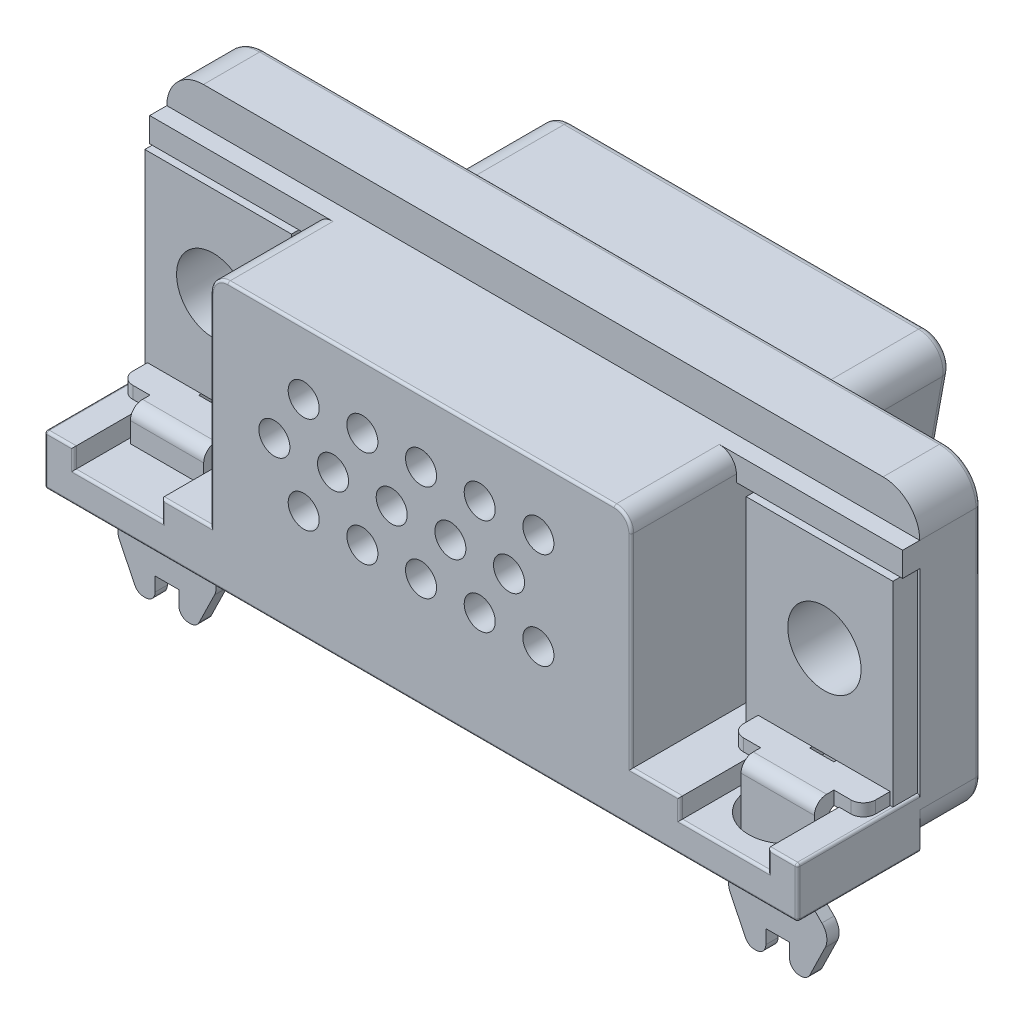
from build123d import *

# Parameters (mm, degrees)
EXTRUDE_1_DEPTH     = 2.5
EXTRUDE_3_DEPTH     = 5
SKETCH_3_W          = 30.8
SKETCH_3_H          = 1
EXTRUDE_4_DEPTH     = 0.7
FILLET_1_R          = 0.7
EXTRUDE_5_DEPTH     = 5.9
CUT_EXTRUDE_1_DEPTH = 0.1
FILLET_2_R          = 0.3
SKETCH_6_R          = 1.5
CUT_EXTRUDE_2_DEPTH = 19.242412806
SKETCH_7_R          = 0.635
CUT_EXTRUDE_3_DEPTH = 16.1
FILLET_3_R          = 0.15
FILLET_4_R          = 0.3
SKETCH_8_R          = 1.6
CUT_EXTRUDE_4_DEPTH = 9.1
FILLET_5_R          = 0.2
SKETCH_9_W          = 6
SKETCH_9_H          = 8
EXTRUDE_6_DEPTH     = 1
EXTRUDE_7_DEPTH     = 0.5
SKETCH_11_W         = 3
SKETCH_11_H         = 0.5
EXTRUDE_8_DEPTH     = 5
FILLET_6_R          = 0.5
SKETCH_12_R         = 0.7
CUT_EXTRUDE_5_DEPTH = 0.5
CUT_EXTRUDE_6_DEPTH = 7
SKETCH_14_R         = 1.5
CUT_EXTRUDE_7_DEPTH = 7
EXTRUDE_9_DEPTH     = 0.5
FILLET_9_R          = 0.1


# Some blends are built 0.0001 mm under size
with BuildPart() as part:
    # Эскиз1 → Бобышка-Вытянуть1 (new body)
    with BuildSketch(Plane.XY):
        with BuildLine():
            Line((-13.9, -6.275), (13.9, -6.275))
            ThreePointArc((13.9, -6.275), (14.960660172, -5.835660172), (15.4, -4.775))
            Line((15.4, -4.775), (15.4, 4.775))
            ThreePointArc((15.4, 4.775), (14.960660172, 5.835660172), (13.9, 6.275))
            Line((13.9, 6.275), (-13.9, 6.275))
            ThreePointArc((-13.9, 6.275), (-14.960660172, 5.835660172), (-15.4, 4.775))
            Line((-15.4, 4.775), (-15.4, -4.775))
            ThreePointArc((-15.4, -4.775), (-14.960660172, -5.835660172), (-13.9, -6.275))
        make_face()
    extrude(amount=EXTRUDE_1_DEPTH)

    # Эскиз2 → Бобышка-Вытянуть3 (add)
    with BuildSketch(Plane.XY.offset(2.5)):
        Polygon((-8.6, -4.225), (-8.6, 4.775), (8.6, 4.775), (8.6, -4.225), (10.6, -4.225), (10.6, -5.047700411), (14.2, -5.047700411), (14.2, -4.225), (15.4, -4.225), (15.4, -6.275), (-15.4, -6.275), (-15.4, -4.225), (-14.2, -4.225), (-14.2, -5.047700411), (-10.6, -5.047700411), (-10.6, -4.225), align=None)
    extrude(amount=EXTRUDE_3_DEPTH)

    # Эскиз3 → Бобышка-Вытянуть4 (add)
    with BuildSketch(Plane.XY.offset(2.5)):
        with Locations((0, 4.275)):
            Rectangle(SKETCH_3_W, SKETCH_3_H)
    extrude(amount=EXTRUDE_4_DEPTH)

    # Скругление1
    fillet_1_edges = [part.edges().sort_by_distance(p)[0] for p in [
        (8.6, 4.775, 5.35),
        (-8.6, 4.775, 5.35),
    ]]
    fillet(fillet_1_edges, radius=FILLET_1_R)

    # Эскиз4 → Бобышка-Вытянуть5 (add)
    with BuildSketch(Plane(origin=(0, 0, 0), x_dir=(-1, 0, 0), z_dir=(0, 0, -1))):
        with BuildLine():
            Line((-7.249750965, 4.130528622), (7.249750965, 4.130528622))
            ThreePointArc((7.249750965, 4.130528622), (8.018037572, 3.77063462), (8.233320696, 2.95))
            Line((8.233320696, 2.95), (7.150409304, -2.95))
            ThreePointArc((7.150409304, -2.95), (6.806945571, -3.537757986), (6.166839572, -3.769471378))
            Line((6.166839572, -3.769471378), (-6.166839572, -3.769471378))
            ThreePointArc((-6.166839572, -3.769471378), (-6.806945571, -3.537757986), (-7.150409304, -2.95))
            Line((-7.150409304, -2.95), (-8.233320696, 2.95))
            ThreePointArc((-8.233320696, 2.95), (-8.018037572, 3.77063462), (-7.249750965, 4.130528622))
        make_face()
    extrude(amount=EXTRUDE_5_DEPTH)

    # Эскиз5 → Вырез-Вытянуть1 (cut)
    with BuildSketch(Plane(origin=(0, 0, -5.9), x_dir=(-1, 0, 0), z_dir=(0, 0, -1))):
        with BuildLine():
            Line((6.658624438, -2.859735689), (7.74153583, 3.040264311))
            ThreePointArc((7.74153583, 3.040264311), (7.633894268, 3.450581621), (7.249750965, 3.630528622))
            Line((7.249750965, 3.630528622), (-7.249750965, 3.630528622))
            ThreePointArc((-7.249750965, 3.630528622), (-7.633894268, 3.450581621), (-7.74153583, 3.040264311))
            Line((-7.74153583, 3.040264311), (-6.658624438, -2.859735689))
            ThreePointArc((-6.658624438, -2.859735689), (-6.486892571, -3.153614682), (-6.166839572, -3.269471378))
            Line((-6.166839572, -3.269471378), (6.166839572, -3.269471378))
            ThreePointArc((6.166839572, -3.269471378), (6.486892571, -3.153614682), (6.658624438, -2.859735689))
        make_face()
    extrude(amount=-CUT_EXTRUDE_1_DEPTH, mode=Mode.SUBTRACT)

    # Скругление2
    fillet_2_edges = [part.edges().sort_by_distance(p)[0] for p in [
        (-6.806945571, -3.537757986, 0),
        (-7.691865, 0, 0),
        (-8.018037572, 3.77063462, 0),
        (0, 4.130528622, 0),
        (8.018037572, 3.77063462, 0),
        (7.691865, 0, 0),
        (6.806945571, -3.537757986, 0),
        (0, -3.769471378, 0),
        (-6.806945571, -3.537757986, -5.9),
        (-7.691865, 0, -5.9),
        (-8.018037572, 3.77063462, -5.9),
        (0, 4.130528622, -5.9),
        (8.018037572, 3.77063462, -5.9),
        (7.691865, 0, -5.9),
        (6.806945571, -3.537757986, -5.9),
        (0, -3.769471378, -5.9),
    ]]
    fillet(fillet_2_edges, radius=FILLET_2_R)

    # Эскиз6 → Вырез-Вытянуть2 (cut, through all)
    with BuildSketch(Plane(origin=(0, 0, 0), x_dir=(-1, 0, 0), z_dir=(0, 0, -1))):
        with Locations((-12.5, 0)):
            Circle(SKETCH_6_R)
        with Locations((12.5, 0)):
            Circle(SKETCH_6_R)
    extrude(amount=-CUT_EXTRUDE_2_DEPTH, mode=Mode.SUBTRACT)

    # Эскиз7 → Вырез-Вытянуть3 (cut)
    with BuildSketch(Plane(origin=(0, 0, -5.8), x_dir=(-1, 0, 0), z_dir=(0, 0, -1))):
        with Locations((-4.8, 2.170528622)):
            Circle(SKETCH_7_R)
        with Locations((-2.4, 2.170528622)):
            Circle(SKETCH_7_R)
        with Locations((0, 2.170528622)):
            Circle(SKETCH_7_R)
        with Locations((2.4, 2.170528622)):
            Circle(SKETCH_7_R)
        with Locations((4.8, 2.170528622)):
            Circle(SKETCH_7_R)
        with Locations((-3.6, 0.190528622)):
            Circle(SKETCH_7_R)
        with Locations((-4.8, -1.789471378)):
            Circle(SKETCH_7_R)
        with Locations((-1.2, 0.190528622)):
            Circle(SKETCH_7_R)
        with Locations((1.2, 0.190528622)):
            Circle(SKETCH_7_R)
        with Locations((3.6, 0.190528622)):
            Circle(SKETCH_7_R)
        with Locations((6, 0.190528622)):
            Circle(SKETCH_7_R)
        with Locations((-2.4, -1.789471378)):
            Circle(SKETCH_7_R)
        with Locations((0, -1.789471378)):
            Circle(SKETCH_7_R)
        with Locations((2.4, -1.789471378)):
            Circle(SKETCH_7_R)
        with Locations((4.8, -1.789471378)):
            Circle(SKETCH_7_R)
    extrude(amount=-CUT_EXTRUDE_3_DEPTH, mode=Mode.SUBTRACT)

    # Скругление3
    fillet_3_edges = [part.edges().sort_by_distance(p)[0] for p in [
        (5.435, 2.170528622, -5.8),
        (3.035, 2.170528622, -5.8),
        (0.635, 2.170528622, -5.8),
        (-1.765, 2.170528622, -5.8),
        (-4.165, 2.170528622, -5.8),
        (4.235, 0.190528622, -5.8),
        (5.435, -1.789471378, -5.8),
        (1.835, 0.190528622, -5.8),
        (-0.565, 0.190528622, -5.8),
        (-2.965, 0.190528622, -5.8),
        (-5.365, 0.190528622, -5.8),
        (3.035, -1.789471378, -5.8),
        (0.635, -1.789471378, -5.8),
        (-1.765, -1.789471378, -5.8),
        (-4.165, -1.789471378, -5.8),
    ]]
    fillet(fillet_3_edges, radius=FILLET_3_R)

    # Скругление4
    fillet_4_edges = [part.edges().sort_by_distance(p)[0] for p in [
        (14, 0, 0),
        (-11, 0, 0),
    ]]
    fillet(fillet_4_edges, radius=FILLET_4_R)

    # Эскиз8 → Вырез-Вытянуть4 (cut)
    with BuildSketch(Plane.XZ.offset(6.275)):
        with Locations((-12.5, 11.4)):
            Circle(SKETCH_8_R)
        with Locations(Location((12.5, 5, 0), (0, 0, 270))):
            Circle(SKETCH_8_R)
    extrude(amount=-CUT_EXTRUDE_4_DEPTH, mode=Mode.SUBTRACT)

    # Скругление5
    fillet_5_edges = [part.edges().sort_by_distance(p)[0] for p in [
        (15.4, 0, 0),
        (14.960660172, -5.835660172, 0),
        (0, -6.275, 0),
        (-14.960660172, -5.835660172, 0),
        (-15.4, 0, 0),
        (-14.960660172, 5.835660172, 0),
        (0, 6.275, 0),
        (14.960660172, 5.835660172, 0),
    ]]
    fillet(fillet_5_edges, radius=FILLET_5_R)

    # Эскиз9 → Бобышка-Вытянуть6 (add)
    with BuildSketch(Plane.XY.offset(2.5)):
        with Locations((-12.3, -0.225)):
            Rectangle(SKETCH_9_W, SKETCH_9_H)
        with Locations((12.3, -0.225)):
            Rectangle(SKETCH_9_W, SKETCH_9_H)
    extrude(amount=EXTRUDE_6_DEPTH)

    # Эскиз10 → Бобышка-Вытянуть7 (add)
    with BuildSketch(Plane(origin=(0, -4.225, 0), x_dir=(1, 0, 0), z_dir=(0, 1, 0))):
        with BuildLine():
            Line((-13.990055245, -5.4), (-10.990055245, -5.4))
            Line((-10.990055245, -5.4), (-10.990055245, -4.6))
            Line((-10.990055245, -4.6), (-10.290055245, -4.6))
            ThreePointArc((-10.290055245, -4.6), (-9.936501855, -4.453553391), (-9.790055245, -4.1))
            Line((-9.790055245, -4.1), (-9.790055245, -3.5))
            Line((-9.790055245, -3.5), (-15.190055245, -3.5))
            Line((-15.190055245, -3.5), (-15.190055245, -4.1))
            ThreePointArc((-15.190055245, -4.1), (-15.043608636, -4.453553391), (-14.690055245, -4.6))
            Line((-14.690055245, -4.6), (-13.990055245, -4.6))
            Line((-13.990055245, -4.6), (-13.990055245, -5.4))
        make_face()
        with BuildLine():
            Line((15.190055245, -3.5), (9.790055245, -3.5))
            Line((9.790055245, -3.5), (9.790055245, -4.1))
            ThreePointArc((9.790055245, -4.1), (9.936501855, -4.453553391), (10.290055245, -4.6))
            Line((10.290055245, -4.6), (10.990055245, -4.6))
            Line((10.990055245, -4.6), (10.990055245, -5.4))
            Line((10.990055245, -5.4), (13.990055245, -5.4))
            Line((13.990055245, -5.4), (13.990055245, -4.6))
            Line((13.990055245, -4.6), (14.690055245, -4.6))
            ThreePointArc((14.690055245, -4.6), (15.043608636, -4.453553391), (15.190055245, -4.1))
            Line((15.190055245, -4.1), (15.190055245, -3.5))
        make_face()
    extrude(amount=EXTRUDE_7_DEPTH)

    # Эскиз11 → Бобышка-Вытянуть8 (add)
    with BuildSketch(Plane.XZ.offset(4.225)):
        with Locations((-12.490055245, 5.15)):
            Rectangle(SKETCH_11_W, SKETCH_11_H)
        with Locations((12.490055245, 5.15)):
            Rectangle(SKETCH_11_W, SKETCH_11_H)
    extrude(amount=EXTRUDE_8_DEPTH)

    # Скругление6
    # the kernel refuses this fillet: 0.5 mm, written as the material it adds along each edge
    with BuildSketch(Plane(origin=(9.740055245, -4.225, 4.9), x_dir=(0, -1, 0), z_dir=(1, 0, 0))) as fillet_6_piece_1_section:
        with BuildLine():
            CenterArc((FILLET_6_R, FILLET_6_R), FILLET_6_R, 180, 90)
            Line((0, FILLET_6_R), (0, 0))
            Line((0, 0), (FILLET_6_R, 0))
        make_face()
    fillet_6_piece_1 = extrude(amount=4.25, mode=Mode.PRIVATE)
    fillet_6_piece_1 = split(fillet_6_piece_1, bisect_by=Plane(origin=(10.990055245, -4.230065924, 4.529125667), z_dir=(-1, 0, 0)), keep=Keep.TOP, mode=Mode.PRIVATE)
    fillet_6_piece_1 = split(fillet_6_piece_1, bisect_by=Plane(origin=(10.365055245, -4.230065924, 4.6), z_dir=(0, 0, -1)), keep=Keep.TOP, mode=Mode.PRIVATE)
    add(fillet_6_piece_1)
    with BuildSketch(Plane(origin=(10.990055245, -4.225, 4.9), x_dir=(0, -1, 0), z_dir=(1, 0, 0))) as fillet_6_piece_2_section:
        with BuildLine():
            CenterArc((FILLET_6_R, FILLET_6_R), FILLET_6_R, 180, 90)
            Line((0, FILLET_6_R), (0, 0))
            Line((0, 0), (FILLET_6_R, 0))
        make_face()
    fillet_6_piece_2 = extrude(amount=3, mode=Mode.PRIVATE)
    fillet_6_piece_2 = split(fillet_6_piece_2, bisect_by=Plane(origin=(12.490055245, -4.346872588, 4.6), z_dir=(0, 0, 1)), keep=Keep.TOP, mode=Mode.PRIVATE)
    add(fillet_6_piece_2)
    with BuildSketch(Plane(origin=(10.990055245, -4.225, 4.9), x_dir=(0, -1, 0), z_dir=(1, 0, 0))) as fillet_6_piece_3_section:
        with BuildLine():
            CenterArc((FILLET_6_R, FILLET_6_R), FILLET_6_R, 180, 90)
            Line((0, FILLET_6_R), (0, 0))
            Line((0, 0), (FILLET_6_R, 0))
        make_face()
    fillet_6_piece_3 = extrude(amount=3, mode=Mode.PRIVATE)
    fillet_6_piece_3 = split(fillet_6_piece_3, bisect_by=Plane(origin=(12.490055245, -4.230065924, 4.6), z_dir=(0, 0, -1)), keep=Keep.TOP, mode=Mode.PRIVATE)
    add(fillet_6_piece_3)
    with BuildSketch(Plane(origin=(10.990055245, -4.225, 4.9), x_dir=(0, -1, 0), z_dir=(1, 0, 0))) as fillet_6_piece_4_section:
        with BuildLine():
            CenterArc((FILLET_6_R, FILLET_6_R), FILLET_6_R, 180, 90)
            Line((0, FILLET_6_R), (0, 0))
            Line((0, 0), (FILLET_6_R, 0))
        make_face()
    fillet_6_piece_4 = extrude(amount=4.25, mode=Mode.PRIVATE)
    fillet_6_piece_4 = split(fillet_6_piece_4, bisect_by=Plane(origin=(13.990055245, -4.230065924, 4.529125667), z_dir=(1, 0, 0)), keep=Keep.TOP, mode=Mode.PRIVATE)
    fillet_6_piece_4 = split(fillet_6_piece_4, bisect_by=Plane(origin=(14.615055245, -4.230065924, 4.6), z_dir=(0, 0, -1)), keep=Keep.TOP, mode=Mode.PRIVATE)
    add(fillet_6_piece_4)
    with BuildSketch(Plane(origin=(-9.740055245, -4.225, 4.9), x_dir=(0, 0, -1), z_dir=(-1, 0, 0))) as fillet_6_piece_5_section:
        with BuildLine():
            CenterArc((FILLET_6_R, FILLET_6_R), FILLET_6_R, 180, 90)
            Line((0, FILLET_6_R), (0, 0))
            Line((0, 0), (FILLET_6_R, 0))
        make_face()
    fillet_6_piece_5 = extrude(amount=4.25, mode=Mode.PRIVATE)
    fillet_6_piece_5 = split(fillet_6_piece_5, bisect_by=Plane(origin=(-10.365055245, -4.230065924, 4.6), z_dir=(0, 0, -1)), keep=Keep.TOP, mode=Mode.PRIVATE)
    fillet_6_piece_5 = split(fillet_6_piece_5, bisect_by=Plane(origin=(-10.990055245, -4.230065924, 4.529125667), z_dir=(1, 0, 0)), keep=Keep.TOP, mode=Mode.PRIVATE)
    add(fillet_6_piece_5)
    with BuildSketch(Plane(origin=(-10.990055245, -4.225, 4.9), x_dir=(0, 0, -1), z_dir=(-1, 0, 0))) as fillet_6_piece_6_section:
        with BuildLine():
            CenterArc((FILLET_6_R, FILLET_6_R), FILLET_6_R, 180, 90)
            Line((0, FILLET_6_R), (0, 0))
            Line((0, 0), (FILLET_6_R, 0))
        make_face()
    fillet_6_piece_6 = extrude(amount=3, mode=Mode.PRIVATE)
    fillet_6_piece_6 = split(fillet_6_piece_6, bisect_by=Plane(origin=(-12.490055245, -4.230065924, 4.6), z_dir=(0, 0, -1)), keep=Keep.TOP, mode=Mode.PRIVATE)
    add(fillet_6_piece_6)
    with BuildSketch(Plane(origin=(-10.990055245, -4.225, 4.9), x_dir=(0, 0, -1), z_dir=(-1, 0, 0))) as fillet_6_piece_7_section:
        with BuildLine():
            CenterArc((FILLET_6_R, FILLET_6_R), FILLET_6_R, 180, 90)
            Line((0, FILLET_6_R), (0, 0))
            Line((0, 0), (FILLET_6_R, 0))
        make_face()
    fillet_6_piece_7 = extrude(amount=3, mode=Mode.PRIVATE)
    fillet_6_piece_7 = split(fillet_6_piece_7, bisect_by=Plane(origin=(-12.490055245, -4.346872588, 4.6), z_dir=(0, 0, 1)), keep=Keep.TOP, mode=Mode.PRIVATE)
    add(fillet_6_piece_7)
    with BuildSketch(Plane(origin=(-10.990055245, -4.225, 4.9), x_dir=(0, 0, -1), z_dir=(-1, 0, 0))) as fillet_6_piece_8_section:
        with BuildLine():
            CenterArc((FILLET_6_R, FILLET_6_R), FILLET_6_R, 180, 90)
            Line((0, FILLET_6_R), (0, 0))
            Line((0, 0), (FILLET_6_R, 0))
        make_face()
    fillet_6_piece_8 = extrude(amount=4.25, mode=Mode.PRIVATE)
    fillet_6_piece_8 = split(fillet_6_piece_8, bisect_by=Plane(origin=(-14.615055245, -4.230065924, 4.6), z_dir=(0, 0, -1)), keep=Keep.TOP, mode=Mode.PRIVATE)
    fillet_6_piece_8 = split(fillet_6_piece_8, bisect_by=Plane(origin=(-13.990055245, -4.230065924, 4.529125667), z_dir=(-1, 0, 0)), keep=Keep.TOP, mode=Mode.PRIVATE)
    add(fillet_6_piece_8)
    # the kernel refuses this fillet: 0.5 mm, written as the material it takes off along each edge
    with BuildSketch(Plane(origin=(9.740055245, -3.725, 5.4), x_dir=(0, -1, 0), z_dir=(1, 0, 0)), Plane(origin=(-15.240055245, -3.725, 5.4), x_dir=(0, -1, 0), z_dir=(1, 0, 0))) as fillet_6_2_piece_1:
        with BuildLine():
            CenterArc((FILLET_6_R, FILLET_6_R), FILLET_6_R, 180, 90)
            Line((0, FILLET_6_R), (0, 0))
            Line((0, 0), (FILLET_6_R, 0))
        make_face()
    extrude(amount=5.5, mode=Mode.SUBTRACT)

    # Эскиз12 → Вырез-Вытянуть5 (cut)
    with BuildSketch(Plane(origin=(0, -3.725, 0), x_dir=(1, 0, 0), z_dir=(0, 1, 0))):
        with Locations(Location((-12.490055245, -0.8, 0), (0, 0, 180))):
            Circle(SKETCH_12_R)
        with Locations(Location((12.490055245, -0.8, 0), (0, 0, 180))):
            Circle(SKETCH_12_R)
    extrude(amount=-CUT_EXTRUDE_5_DEPTH, mode=Mode.SUBTRACT)

    # Эскиз13 → Вырез-Вытянуть6 (cut)
    with BuildSketch(Plane(origin=(0, -3.725, 0), x_dir=(1, 0, 0), z_dir=(0, 1, 0))):
        with BuildLine():
            ThreePointArc((-11.995453545, -1.295347513), (-12.493890587, -1.499989493), (-12.990055245, -1.289897949))
            Line((-12.990055245, -1.289897949), (-12.990055245, -3.603621507))
            Line((-12.990055245, -3.603621507), (-12.005897844, -3.605845872))
            Line((-12.005897844, -3.605845872), (-11.995453545, -1.295347513))
        make_face()
    cut_extrude_6 = extrude(amount=-CUT_EXTRUDE_6_DEPTH, mode=Mode.SUBTRACT)

    # Зеркальное отражение1: Вырез-Вытянуть6 across plane
    add(cut_extrude_6.mirror(Plane(origin=(0, 0, 0), x_dir=(0, 0, 1), z_dir=(1, 0, 0))), mode=Mode.SUBTRACT)

    # Эскиз14 → Вырез-Вытянуть7 (cut)
    with BuildSketch(Plane(origin=(0, 0, 2.5), x_dir=(-1, 0, 0), z_dir=(0, 0, -1))):
        with Locations(Location((12.5, 0, 0), (0, 0, 180))):
            Circle(SKETCH_14_R)
        with Locations((-12.5, 0)):
            Circle(SKETCH_14_R)
    extrude(amount=-CUT_EXTRUDE_7_DEPTH, mode=Mode.SUBTRACT)

    # Эскиз15 → Бобышка-Вытянуть9 (add)
    with BuildSketch(Plane.XY.offset(5.4)):
        with BuildLine():
            Line((10.990055245, -7.575), (10.683208304, -7.881846941))
            ThreePointArc((10.683208304, -7.881846941), (10.487779531, -8.26130987), (10.549046337, -8.683720686))
            Line((10.549046337, -8.683720686), (11.175823232, -9.96860059))
            ThreePointArc((11.175823232, -9.96860059), (11.323372787, -10.132455574), (11.535329925, -10.193229733))
            Line((11.535329925, -10.193229733), (11.604282006, -10.193229733))
            ThreePointArc((11.604282006, -10.193229733), (11.886504212, -10.076691595), (12.004278165, -9.794982868))
            Line((12.004278165, -9.794982868), (12.014008078, -7.575))
            Line((12.014008078, -7.575), (10.990055245, -7.575))
        make_face()
        with BuildLine():
            Line((12.966102413, -7.575), (13.990055245, -7.575))
            Line((13.990055245, -7.575), (14.296902186, -7.881846941))
            ThreePointArc((14.296902186, -7.881846941), (14.492330959, -8.26130987), (14.431064153, -8.683720686))
            Line((14.431064153, -8.683720686), (13.804287259, -9.96860059))
            ThreePointArc((13.804287259, -9.96860059), (13.656737704, -10.132455574), (13.444780565, -10.193229733))
            Line((13.444780565, -10.193229733), (13.375828484, -10.193229733))
            ThreePointArc((13.375828484, -10.193229733), (13.093606279, -10.076691595), (12.975832326, -9.794982868))
            Line((12.975832326, -9.794982868), (12.966102413, -7.575))
        make_face()
        with BuildLine():
            Line((-13.990055245, -7.575), (-14.296902186, -7.881846941))
            ThreePointArc((-14.296902186, -7.881846941), (-14.492330959, -8.26130987), (-14.431064153, -8.683720686))
            Line((-14.431064153, -8.683720686), (-13.804287259, -9.96860059))
            ThreePointArc((-13.804287259, -9.96860059), (-13.656737704, -10.132455574), (-13.444780565, -10.193229733))
            Line((-13.444780565, -10.193229733), (-13.375828484, -10.193229733))
            ThreePointArc((-13.375828484, -10.193229733), (-13.093606279, -10.076691595), (-12.975832326, -9.794982868))
            Line((-12.975832326, -9.794982868), (-12.966102413, -7.575))
            Line((-12.966102413, -7.575), (-13.990055245, -7.575))
        make_face()
        with BuildLine():
            Line((-12.014008078, -7.575), (-10.990055245, -7.575))
            Line((-10.990055245, -7.575), (-10.683208304, -7.881846941))
            ThreePointArc((-10.683208304, -7.881846941), (-10.487779531, -8.26130987), (-10.549046337, -8.683720686))
            Line((-10.549046337, -8.683720686), (-11.175823232, -9.96860059))
            ThreePointArc((-11.175823232, -9.96860059), (-11.323372787, -10.132455574), (-11.535329925, -10.193229733))
            Line((-11.535329925, -10.193229733), (-11.604282006, -10.193229733))
            ThreePointArc((-11.604282006, -10.193229733), (-11.886504212, -10.076691595), (-12.004278165, -9.794982868))
            Line((-12.004278165, -9.794982868), (-12.014008078, -7.575))
        make_face()
    extrude(amount=-EXTRUDE_9_DEPTH)

    # Скругление9
    fillet_9_edges = [part.edges().sort_by_distance(p)[0] for p in [
        (9.6, -4.225, 7.5),
        (10.6, -4.636350205, 7.5),
        (12.4, -5.047700411, 7.5),
        (14.2, -4.636350205, 7.5),
        (14.8, -4.225, 7.5),
        (15.4, -5.25, 7.5),
        (0, -6.275, 7.5),
        (-15.4, -5.25, 7.5),
        (-14.8, -4.225, 7.5),
        (-14.2, -4.636350205, 7.5),
        (-12.4, -5.047700411, 7.5),
        (-10.6, -4.636350205, 7.5),
        (-9.6, -4.225, 7.5),
        (-8.6, -0.075, 7.5),
        (-8.394974747, 4.569974747, 7.5),
        (0, 4.775, 7.5),
        (8.394974747, 4.569974747, 7.5),
        (8.6, -0.075, 7.5),
        (15.4, -6.275, 5),
        (15.4, -4.225, 5),
        (-15.4, -6.275, 5),
        (-15.4, -4.225, 5),
    ]]
    fillet(fillet_9_edges, radius=FILLET_9_R - 0.0001)  # a hair under: the kernel refuses the full size


solid = part.part
